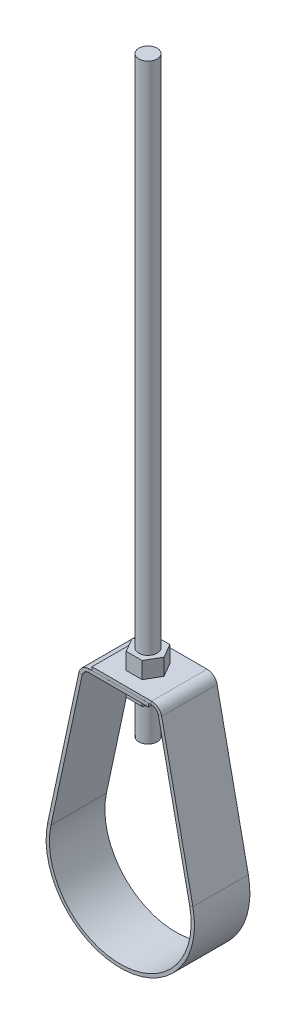
from build123d import *

# Parameters (mm, degrees)
BASE_FLANGE1_DEPTH              = 14.2875
F_1_2_START                     = 85.47608
F_1_2_CLEARANCE_HOLE2_OUTLINE_R = 4.9022
F_1_2_CLEARANCE_HOLE2_DEPTH     = 3.42138
NUT_SKETCH_R                    = 3.96875
NUT_DEPTH                       = 8.5598
ROD_SKETCH_W                    = 4.7625
ROD_SKETCH_H                    = 304.8


with BuildPart() as part:
    # Base-Flange1: sheet metal written as solids
    # Sketch1 → Base-Flange1 (new, symmetric)
    with BuildSketch(Plane.XY):
        with BuildLine():
            Line((-14.605508, 87.18804), (16.161402617, 87.18804))
            ThreePointArc((16.161402617, 87.18804), (18.403484856, 86.392149279), (19.641938046, 84.360743731))
            Line((19.641938046, 84.360743731), (35.737640565, 7.482225813))
            ThreePointArc((35.737640565, 7.482225813), (-0.080380921, -36.512411522), (-35.704350556, 7.6395031))
            Line((-35.704350556, 7.6395031), (-19.651666762, 82.664101172))
            ThreePointArc((-19.651666762, 82.664101172), (-18.410374017, 84.685118452), (-16.17437349, 85.47608))
            Line((-16.17437349, 85.47608), (14.605508, 85.47608))
            Line((14.605508, 85.47608), (14.605508, 87.1855))
            Line((14.605508, 87.1855), (-16.17437349, 87.1855))
            ThreePointArc((-16.17437349, 87.1855), (-19.485251413, 86.014311937), (-21.323251313, 83.021762778))
            Line((-21.323251313, 83.021762778), (-37.375935107, 7.997164706))
            ThreePointArc((-37.375935107, 7.997164706), (-0.084144146, -38.22182738), (37.410783667, 7.832524107))
            Line((37.410783667, 7.832524107), (21.315081149, 84.711042025))
            ThreePointArc((21.315081149, 84.711042025), (19.481285818, 87.71897324), (16.161402617, 88.89746))
            Line((16.161402617, 88.89746), (-14.605508, 88.89746))
            Line((-14.605508, 88.89746), (-14.605508, 87.18804))
        make_face()
    extrude(amount=BASE_FLANGE1_DEPTH, both=True)

    # 1/2 Clearance Hole2: read off the stored shape, not the designer's step
    # 1/2 Clearance Hole2 outline → 1/2 Clearance Hole2 (cut)
    with BuildSketch(Plane(origin=(0, 0, 0), x_dir=(1, 0, 0), z_dir=(0, 1, 0)).offset(F_1_2_START)):
        Circle(F_1_2_CLEARANCE_HOLE2_OUTLINE_R)
    extrude(amount=F_1_2_CLEARANCE_HOLE2_DEPTH, mode=Mode.SUBTRACT)


with BuildPart() as body_2:
    # Nut_Sketch → Nut (new body)
    with BuildSketch(Plane(origin=(0, 88.89746, 0), x_dir=(1, 0, 0), z_dir=(0, 1, 0))):
        Polygon((8.241559623, 0), (4.120779811, 7.1374), (-4.120779811, 7.1374), (-8.241559623, 0), (-4.120779811, -7.1374), (4.120779811, -7.1374), align=None)
        with Locations(Location((0, 0, 0), (0, 0, 270))):
            Circle(NUT_SKETCH_R, mode=Mode.SUBTRACT)
    extrude(amount=NUT_DEPTH)


with BuildPart() as body_3:
    # Body-Move/Copy1: copy of body 2
    add(body_2.part.moved(Location((0, -32.460651761, 0))))


with BuildPart() as body_3_1:
    # Body-Move/Copy2: read off the stored shape, not the designer's step
    # Body-Move/Copy2: moved
    add(body_3.part.moved(Location((0, 20.4794718, 0))))


with BuildPart() as body_4:
    # Rod_Sketch → Rod (revolve)
    with BuildSketch(Plane.XY, mode=Mode.PRIVATE) as rod_sk:
        with Locations((2.38125, 210.26628)):
            Rectangle(ROD_SKETCH_W, ROD_SKETCH_H)
    revolve(rod_sk.sketch.rotate(Axis((0, 0, 0), (0, 1, 0)), 270), axis=Axis((0, 0, 0), (0, 1, 0)))


solid = Compound([part.part, body_2.part, body_3_1.part, body_4.part])
